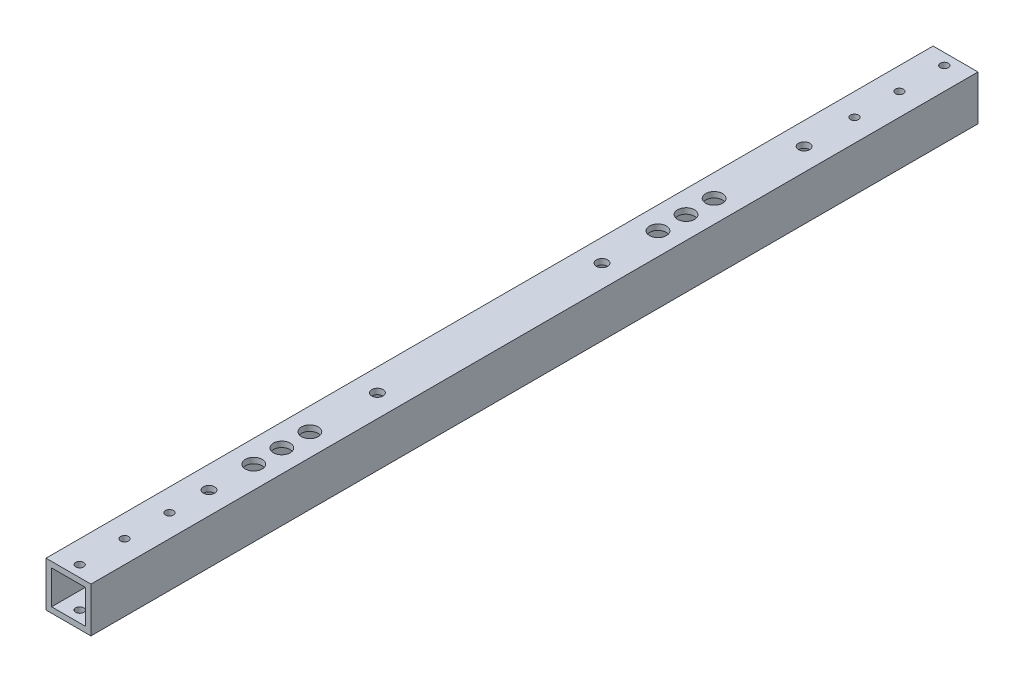
from build123d import *

# Parameters (mm, degrees)
SKETCH1_W                       = 25.4
SKETCH1_H                       = 25.4
SKETCH1_W_2                     = 19.05
SKETCH1_H_2                     = 19.05
EXTRUDE_THIN1_DEPTH             = 501.65
F_8_CLEARANCE_HOLE1_D           = 4.4958
F_1_4_0_25_DIAMETER_HOLE1_D     = 6.35
F_1_4_0_25_DIAMETER_HOLE1_DEPTH = 25.4
F_1_4_0_25_DIAMETER_HOLE1_TIP   = 1.907732465
HOLE_WIZARD_2297_D              = 9.525


with BuildPart() as part:
    # Sketch1 → Extrude-Thin1 (new body)
    with BuildSketch(Plane.XY):
        Rectangle(SKETCH1_W, SKETCH1_H)
        Rectangle(SKETCH1_W_2, SKETCH1_H_2, mode=Mode.SUBTRACT)
    extrude(amount=EXTRUDE_THIN1_DEPTH)

    # #8 Clearance Hole1 (through all)
    with Locations(Plane(origin=(0, 12.7, 495.3), x_dir=(0, 0, 1), z_dir=(0, 1, 0))):
        with Locations((0, 0), (-488.95, 0), (-463.55, 0), (-438.15, 0), (-25.4, 0), (-50.8, 0)):
            Hole(F_8_CLEARANCE_HOLE1_D / 2)

    # 1/4 (0.25) Diameter Hole1
    with Locations(Plane(origin=(0, 12.7, 0), x_dir=(1, 0, 0), z_dir=(0, 1, 0))):
        with Locations((0, -199.933463093), (0, -422.2), (0, -326.95), (0, -85.623539829)):
            Hole(F_1_4_0_25_DIAMETER_HOLE1_D / 2, depth=F_1_4_0_25_DIAMETER_HOLE1_DEPTH)
            with Locations((0, 0, -(F_1_4_0_25_DIAMETER_HOLE1_DEPTH + F_1_4_0_25_DIAMETER_HOLE1_TIP / 2))):  # 118° drill point
                Cone(0, F_1_4_0_25_DIAMETER_HOLE1_D / 2, F_1_4_0_25_DIAMETER_HOLE1_TIP, mode=Mode.SUBTRACT)

    # Hole Wizard 2297 (through all)
    with Locations(Plane(origin=(-381, 12.7, 250.825), x_dir=(1, 0, 0), z_dir=(0, 1, 0))):
        with Locations((381, 82.55), (381, 98.425), (381, 114.3), (381, -146.05), (381, -130.175), (381, -114.3), (-381, -146.05), (-381, -130.175), (-381, -114.3), (-381, 82.55), (-381, 98.425), (-381, 114.3), (-92.583, 346.075), (-35.433, 346.075), (92.964, 346.075), (35.814, 346.075), (-22.9616, -346.775), (50.0634, -346.775), (123.0884, -346.775)):
            Hole(HOLE_WIZARD_2297_D / 2)


solid = part.part
